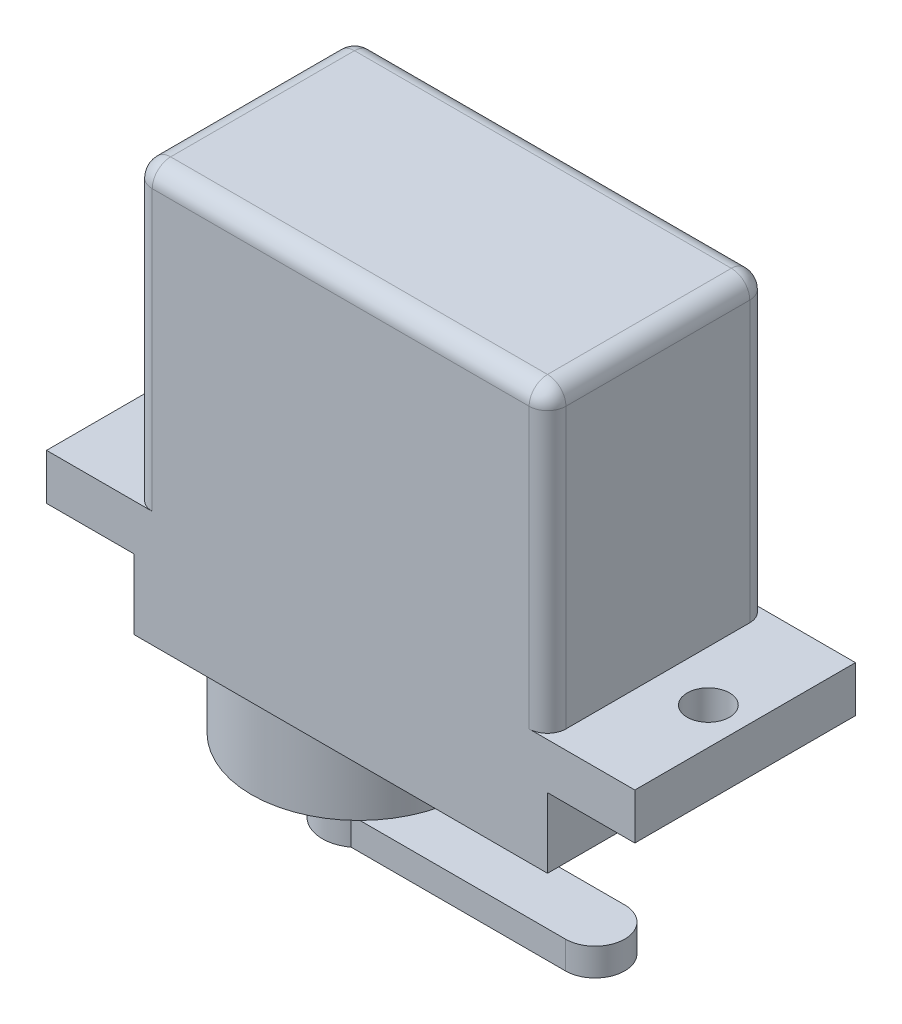
from build123d import *

# Parameters (mm, degrees)
EXTRUDE_1_DEPTH     = 6
SKETCH_2_R          = 1.15
CUT_EXTRUDE_1_DEPTH = 26.331600818
SKETCH_3_R          = 5.85
EXTRUDE_2_DEPTH     = 4.5
SKETCH_4_R          = 2
EXTRUDE_3_DEPTH     = 4
EXTRUDE_4_DEPTH     = 1.5
FILLET_1_R          = 1


with BuildPart() as part:
    # 草图1 → 凸台-拉伸1 (new, symmetric)
    with BuildSketch(Plane.XY):
        Polygon((0, 0), (-11.25, 0), (-11.25, 3.8), (-16, 3.8), (-16, 6.3), (-11.25, 6.3), (-11.25, 22.5), (11.25, 22.5), (11.25, 6.3), (16, 6.3), (16, 3.8), (11.25, 3.8), (11.25, 0), align=None)
    extrude(amount=EXTRUDE_1_DEPTH, both=True)

    # 草图2 → 切除-拉伸1 (cut, through all)
    with BuildSketch(Plane.XZ.offset(-3.8)):
        with Locations((-14, 0)):
            Circle(SKETCH_2_R)
        with Locations((14, 0)):
            Circle(SKETCH_2_R)
    extrude(amount=-CUT_EXTRUDE_1_DEPTH, mode=Mode.SUBTRACT)

    # 草图3 → 凸台-拉伸2 (add)
    with BuildSketch(Plane.XZ):
        with Locations((-5, 0)):
            Circle(SKETCH_3_R)
    extrude(amount=EXTRUDE_2_DEPTH)

    # 草图4 → 凸台-拉伸3 (add)
    with BuildSketch(Plane.XZ.offset(4.5)):
        with Locations((-5, 0)):
            Circle(SKETCH_4_R)
    extrude(amount=EXTRUDE_3_DEPTH)

    # 草图5 → 凸台-拉伸4 (add)
    with BuildSketch(Plane.XZ.offset(8.5)):
        with BuildLine():
            Line((-5, 1.611538932), (7.837939349, 1.611538932))
            ThreePointArc((7.837939349, 1.611538932), (9.449478281, 0), (7.837939349, -1.611538932))
            Line((7.837939349, -1.611538932), (-5, -1.611538932))
            ThreePointArc((-5, -1.611538932), (-6.611538932, 0), (-5, 1.611538932))
        make_face()
    extrude(amount=-EXTRUDE_4_DEPTH)

    # 圆角1
    fillet_1_edges = [part.edges().sort_by_distance(p)[0] for p in [
        (11.25, 22.5, 0),
        (0, 22.5, 6),
        (-11.25, 22.5, 0),
        (0, 22.5, -6),
        (-11.25, 14.4, -6),
        (11.25, 14.4, -6),
        (11.25, 14.4, 6),
        (-11.25, 14.4, 6),
    ]]
    fillet(fillet_1_edges, radius=FILLET_1_R)


solid = part.part
